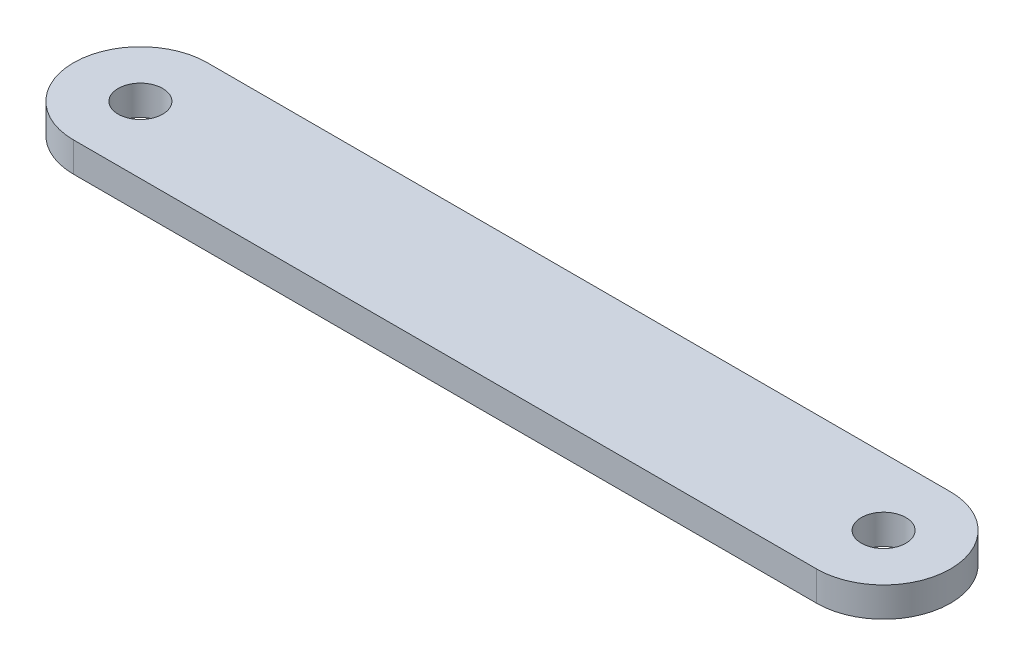
from build123d import *

# Parameters (mm, degrees)
BOSS_EXTRUDE1_DEPTH = 2
SKETCH2_R           = 1.5
CUT_EXTRUDE1_DEPTH  = 2


with BuildPart() as part:
    # Sketch1 → Boss-Extrude1 (new body)
    with BuildSketch(Plane(origin=(0, 0, 0), x_dir=(1, 0, 0), z_dir=(0, 1, 0))):
        with BuildLine():
            Line((-25, 4.5), (25, 4.5))
            ThreePointArc((25, 4.5), (29.5, 0), (25, -4.5))
            Line((25, -4.5), (-25, -4.5))
            ThreePointArc((-25, -4.5), (-29.5, 0), (-25, 4.5))
        make_face()
    extrude(amount=BOSS_EXTRUDE1_DEPTH)

    # Sketch2 → Cut-Extrude1 (cut)
    with BuildSketch(Plane(origin=(0, 2, 0), x_dir=(1, 0, 0), z_dir=(0, 1, 0))):
        with Locations((-25, 0)):
            Circle(SKETCH2_R)
        with Locations((25, 0)):
            Circle(SKETCH2_R)
    extrude(amount=-CUT_EXTRUDE1_DEPTH, mode=Mode.SUBTRACT)


solid = part.part
